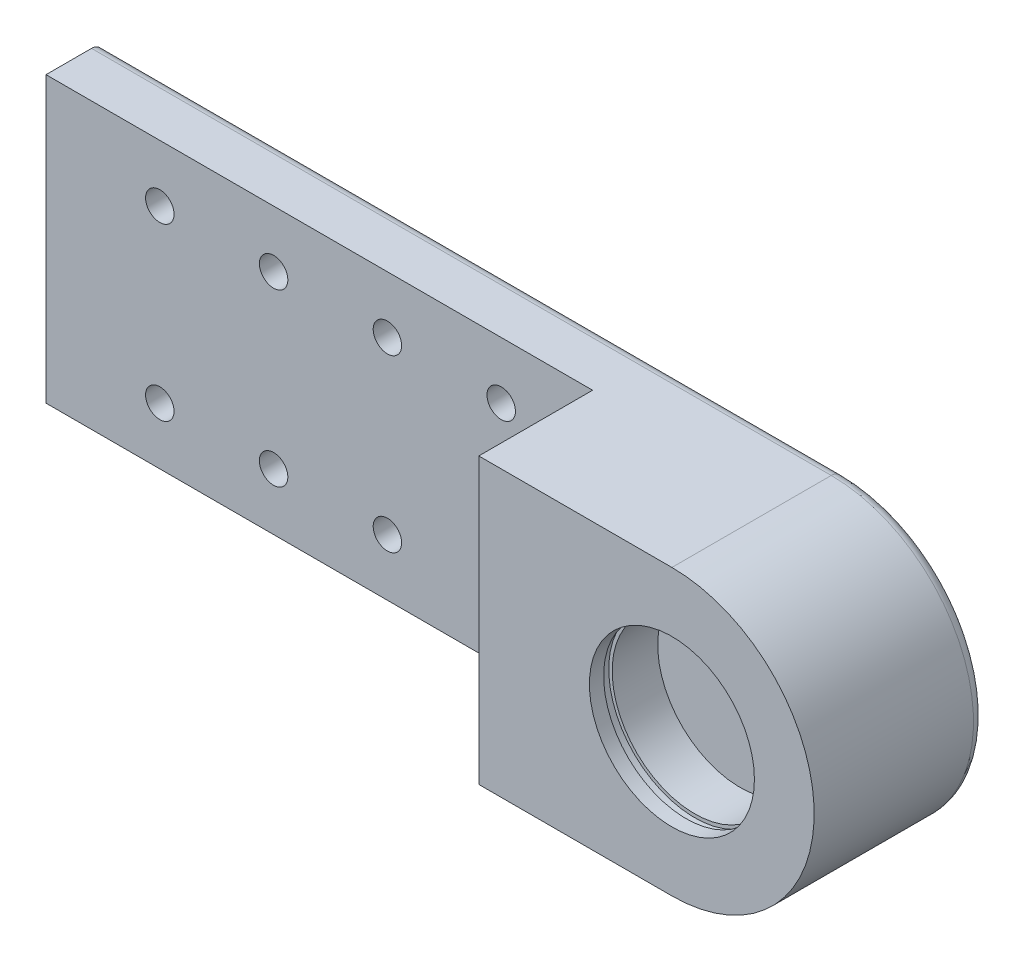
from build123d import *
from build123d.topology import SkipClean

# Parameters (mm, degrees)
SKETCH1_R           = 2.5
BOSS_EXTRUDE1_DEPTH = 30
CUT_EXTRUDE3_START  = 30
SKETCH4_W           = 96.060485436
SKETCH4_H           = 50
CUT_EXTRUDE3_DEPTH  = 20
FILLET1_R           = 2
SKETCH5_R           = 3.175
CUT_EXTRUDE4_DEPTH  = 10
THREAD1_PITCH       = 1.27
CUT_EXTRUDE5_START  = 30
SKETCH6_R           = 14.5
CUT_EXTRUDE5_DEPTH  = 12
CUT_EXTRUDE6_START  = 27.5
SKETCH7_R           = 15.1
CUT_EXTRUDE6_DEPTH  = 1.5


with BuildPart() as part:
    # Sketch1 → Boss-Extrude1 (new body)
    with BuildSketch(Plane.XY):
        with BuildLine():
            Line((70.196204924, 25), (-59.803795076, 25))
            Line((-59.803795076, 25), (-59.803795076, -25))
            Line((-59.803795076, -25), (70.196204924, -25))
            ThreePointArc((70.196204924, -25), (95.196204924, 0), (70.196204924, 25))
        make_face()
        with Locations((-39.803795076, 15)):
            Circle(SKETCH1_R, mode=Mode.SUBTRACT)
        with Locations((-39.803795076, -15)):
            Circle(SKETCH1_R, mode=Mode.SUBTRACT)
        with Locations((-19.803795076, -15)):
            Circle(SKETCH1_R, mode=Mode.SUBTRACT)
        with Locations((0.196204924, -15)):
            Circle(SKETCH1_R, mode=Mode.SUBTRACT)
        with Locations((20.196204924, -15)):
            Circle(SKETCH1_R, mode=Mode.SUBTRACT)
        with Locations((0.196204924, 15)):
            Circle(SKETCH1_R, mode=Mode.SUBTRACT)
        with Locations((20.196204924, 15)):
            Circle(SKETCH1_R, mode=Mode.SUBTRACT)
        with Locations((-19.803795076, 15)):
            Circle(SKETCH1_R, mode=Mode.SUBTRACT)
    extrude(amount=BOSS_EXTRUDE1_DEPTH)

    # Sketch4 → Cut-Extrude3 (cut)
    with BuildSketch(Plane.XY.offset(CUT_EXTRUDE3_START)):
        with Locations((-11.773552358, 0)):
            Rectangle(SKETCH4_W, SKETCH4_H)
    extrude(amount=-CUT_EXTRUDE3_DEPTH, mode=Mode.SUBTRACT)

    # Fillet1
    fillet1_edges = [part.edges().sort_by_distance(p)[0] for p in [
        (5.196204924, 25, 0),
        (95.196204924, 0, 0),
        (5.196204924, -25, 0),
    ]]
    fillet(fillet1_edges, radius=FILLET1_R)

    # Sketch5 → Cut-Extrude4 (cut)
    with BuildSketch(Plane.ZY.offset(59.803795076)):
        with Locations((5, 0)):
            Circle(SKETCH5_R)
    extrude(amount=-CUT_EXTRUDE4_DEPTH, mode=Mode.SUBTRACT)

    # Thread1: the profile of Thread Profile1 profile screwed along a right-hand helix of 7.874016 turns, 8 arcs to a turn; built about Z, then put on its axis
    with SkipClean():  # the faces are left unmerged after this step: merging them gives an invalid solid
        thread1_z = Axis((0, 0, 0), (0, 0, 1))
        thread1_corners = [(3.1747, 0, -0.000173205), (3.862407661, 0, 0.396874998), (3.862407661, 0, 0.555624998), (3.1747, 0, 0.952673202)]
        with BuildLine(mode=Mode.PRIVATE) as thread1_profile:
            Line(thread1_corners[0], thread1_corners[1])
            Line(thread1_corners[1], thread1_corners[2])
            Line(thread1_corners[2], thread1_corners[3])
            Line(thread1_corners[3], thread1_corners[0])
        thread1_cap = Face(thread1_profile.wire())
        thread1_turn_angles = [0, 22.5, 45, 67.5, 90, 112.5, 135, 157.5, 180, 202.5, 225, 247.5, 270, 292.5, 315, 337.5, 360]
        thread1_turn_weights = [1, 0.9238795325112867, 1, 0.9238795325112867, 1, 0.9238795325112867, 1, 0.9238795325112867, 1, 0.9238795325112867, 1, 0.9238795325112867, 1, 0.9238795325112867, 1, 0.9238795325112867, 1]
        thread1_turn_rails = [Edge.make_bspline([Vector(p[0], p[1], 0).rotate(thread1_z, thread1_turn_angles[k]) / thread1_turn_weights[k] + Vector(0, 0, p[2] + THREAD1_PITCH * thread1_turn_angles[k] / 360) for k in range(17)], [0, 0, 0, 1, 1, 2, 2, 3, 3, 4, 4, 5, 5, 6, 6, 7, 7, 8, 8, 8], 2, thread1_turn_weights) for p in thread1_corners]
        thread1_turn_sides = [Face.make_surface_from_curves(thread1_turn_rails[p[0]], thread1_turn_rails[p[1]]) for p in [(0, 1), (1, 2), (2, 3), (3, 0)]]
        thread1_last_angles = [2520, 2542.5, 2565, 2587.5, 2610, 2632.5, 2655, 2677.5, 2700, 2722.5, 2745, 2767.5, 2790, 2812.322834646, 2834.645669291]
        thread1_last_weights = [1, 0.9238795325112867, 1, 0.9238795325112867, 1, 0.9238795325112867, 1, 0.9238795325112867, 1, 0.9238795325112867, 1, 0.9238795325112867, 1, 0.9250584165493104, 1]
        thread1_last_rails = [Edge.make_bspline([Vector(p[0], p[1], 0).rotate(thread1_z, thread1_last_angles[k]) / thread1_last_weights[k] + Vector(0, 0, p[2] + THREAD1_PITCH * thread1_last_angles[k] / 360) for k in range(15)], [0, 0, 0, 1, 1, 2, 2, 3, 3, 4, 4, 5, 5, 6, 6, 7, 7, 7], 2, thread1_last_weights) for p in thread1_corners]
        thread1_last_sides = [Face.make_surface_from_curves(thread1_last_rails[p[0]], thread1_last_rails[p[1]]) for p in [(0, 1), (1, 2), (2, 3), (3, 0)]]
        thread1 = Plane(origin=(-59.803795076, 0, 5), x_dir=(0, 0, -1), z_dir=(1, 0, 0)) * Solid(Shell([*[p.moved(Location((0, 0, THREAD1_PITCH * i))) for i in range(7) for p in thread1_turn_sides], *thread1_last_sides, thread1_cap, thread1_cap.rotate(thread1_z, 2834.645669291).moved(Location((0, 0, THREAD1_PITCH * 2834.645669291 / 360)))]))
        add(thread1, mode=Mode.SUBTRACT)

    # Sketch6 → Cut-Extrude5 (cut)
    with SkipClean():  # the faces are left unmerged after this step: merging them gives an invalid solid
        with BuildSketch(Plane.XY.offset(CUT_EXTRUDE5_START)):
            with Locations((70.196204924, 0)):
                Circle(SKETCH6_R)
        extrude(amount=-CUT_EXTRUDE5_DEPTH, mode=Mode.SUBTRACT)

    # Sketch7 → Cut-Extrude6 (cut)
    with SkipClean():  # the faces are left unmerged after this step: merging them gives an invalid solid
        with BuildSketch(Plane.XY.offset(CUT_EXTRUDE6_START)):
            with Locations((70.196204924, 0)):
                Circle(SKETCH7_R)
        extrude(amount=-CUT_EXTRUDE6_DEPTH, mode=Mode.SUBTRACT)


solid = part.part
